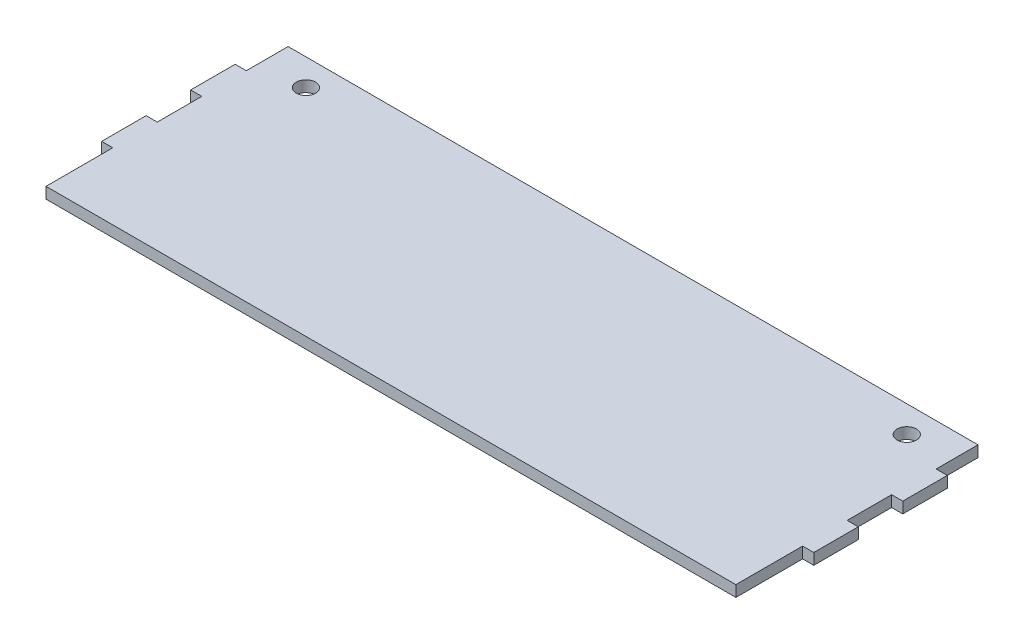
from build123d import *

# Parameters (mm, degrees)
BOSS_EXTRUDE1_DEPTH  = 3.175
M5_CLEARANCE_HOLE1_D = 5.5


with BuildPart() as part:
    # Sketch1 → Boss-Extrude1 (new body)
    with BuildSketch(Plane(origin=(0, 0, 0), x_dir=(1, 0, 0), z_dir=(0, 1, 0))):
        Polygon((200.025, 69.088), (3.175, 69.088), (3.175, 57.15), (0, 57.15), (0, 44.45), (3.175, 44.45), (3.175, 31.75), (0, 31.75), (0, 19.05), (3.175, 19.05), (3.175, 0), (200.025, 0), (200.025, 19.05), (203.2, 19.05), (203.2, 31.75), (200.025, 31.75), (200.025, 44.45), (203.2, 44.45), (203.2, 57.15), (200.025, 57.15), align=None)
    extrude(amount=BOSS_EXTRUDE1_DEPTH)

    # M5 Clearance Hole1 (through all)
    with Locations(Plane(origin=(0, 3.175, 0), x_dir=(1, 0, 0), z_dir=(0, 1, 0))):
        with Locations((15.875, 61.468), (187.325, 61.468)):
            Hole(M5_CLEARANCE_HOLE1_D / 2)


solid = part.part
